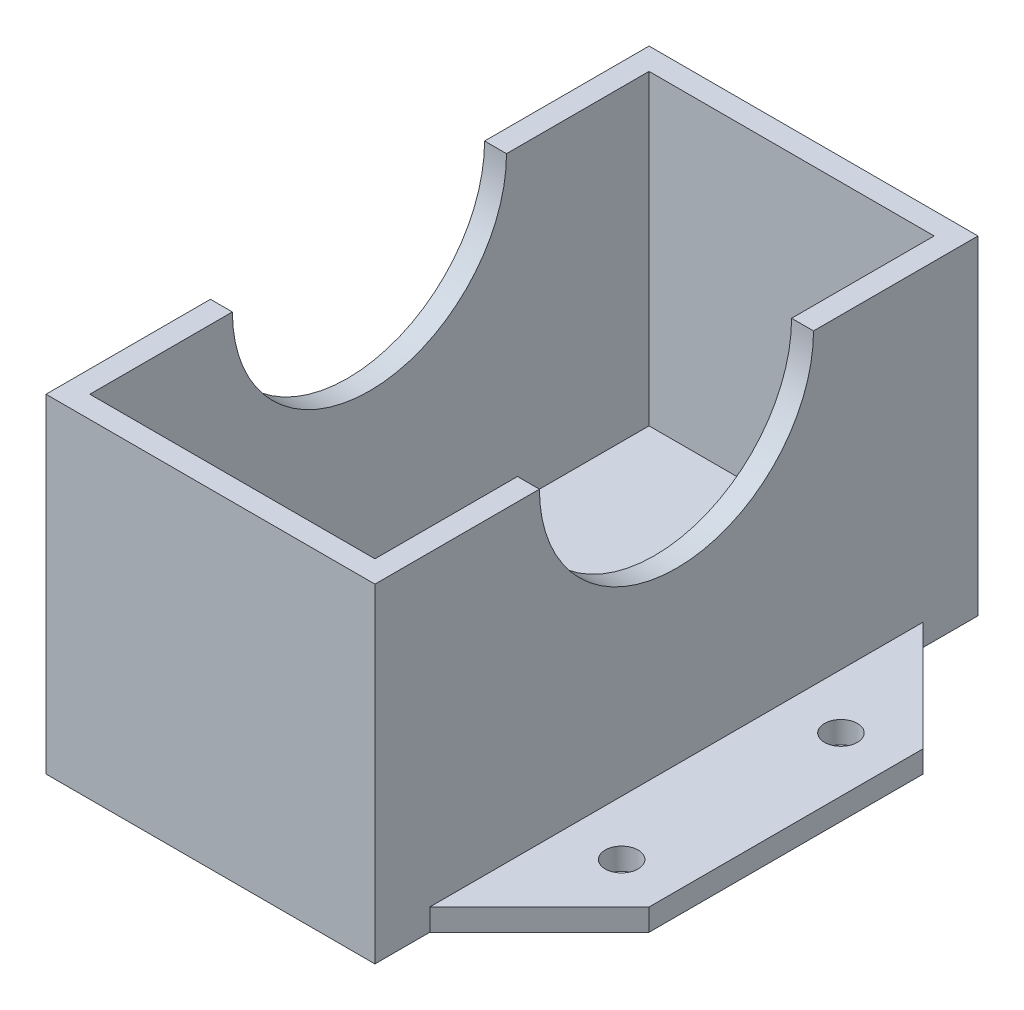
from build123d import *

# Parameters (mm, degrees)
SKETCH1_R           = 1.5
BOSS_EXTRUDE1_DEPTH = 2
SKETCH2_W           = 30
SKETCH2_H           = 55
SKETCH2_W_2         = 26
SKETCH2_H_2         = 51
BOSS_EXTRUDE2_DEPTH = 28
SKETCH3_R           = 12.5
CUT_EXTRUDE1_DEPTH  = 58.063561053


with BuildPart() as part:
    # Sketch1 → Boss-Extrude1 (new body)
    with BuildSketch(Plane(origin=(0, 0, 0), x_dir=(1, 0, 0), z_dir=(0, 1, 0))):
        Polygon((0, -27.5), (0, 27.5), (-15, 27.5), (-15, 22.5), (-25, 12.5), (-25, -12.5), (-15, -22.5), (-15, -27.5), align=None)
        with Locations((-20, 10)):
            Circle(SKETCH1_R, mode=Mode.SUBTRACT)
        with Locations((-20, -10)):
            Circle(SKETCH1_R, mode=Mode.SUBTRACT)
    boss_extrude1 = extrude(amount=BOSS_EXTRUDE1_DEPTH)

    # Mirror1: Boss-Extrude1 across plane
    add(boss_extrude1.mirror(Plane(origin=(0, 0, 0), x_dir=(0, 0, 1), z_dir=(1, 0, 0))))

    # Sketch2 → Boss-Extrude2 (add)
    with BuildSketch(Plane(origin=(0, 2, 0), x_dir=(1, 0, 0), z_dir=(0, 1, 0))):
        Rectangle(SKETCH2_W, SKETCH2_H)
        Rectangle(SKETCH2_W_2, SKETCH2_H_2, mode=Mode.SUBTRACT)
    extrude(amount=BOSS_EXTRUDE2_DEPTH)

    # Sketch3 → Cut-Extrude1 (cut, through all)
    with BuildSketch(Plane(origin=(15, 0, 0), x_dir=(0, 0, -1), z_dir=(1, 0, 0))):
        with Locations((0, 30)):
            Circle(SKETCH3_R)
    extrude(amount=-CUT_EXTRUDE1_DEPTH, mode=Mode.SUBTRACT)


solid = part.part
